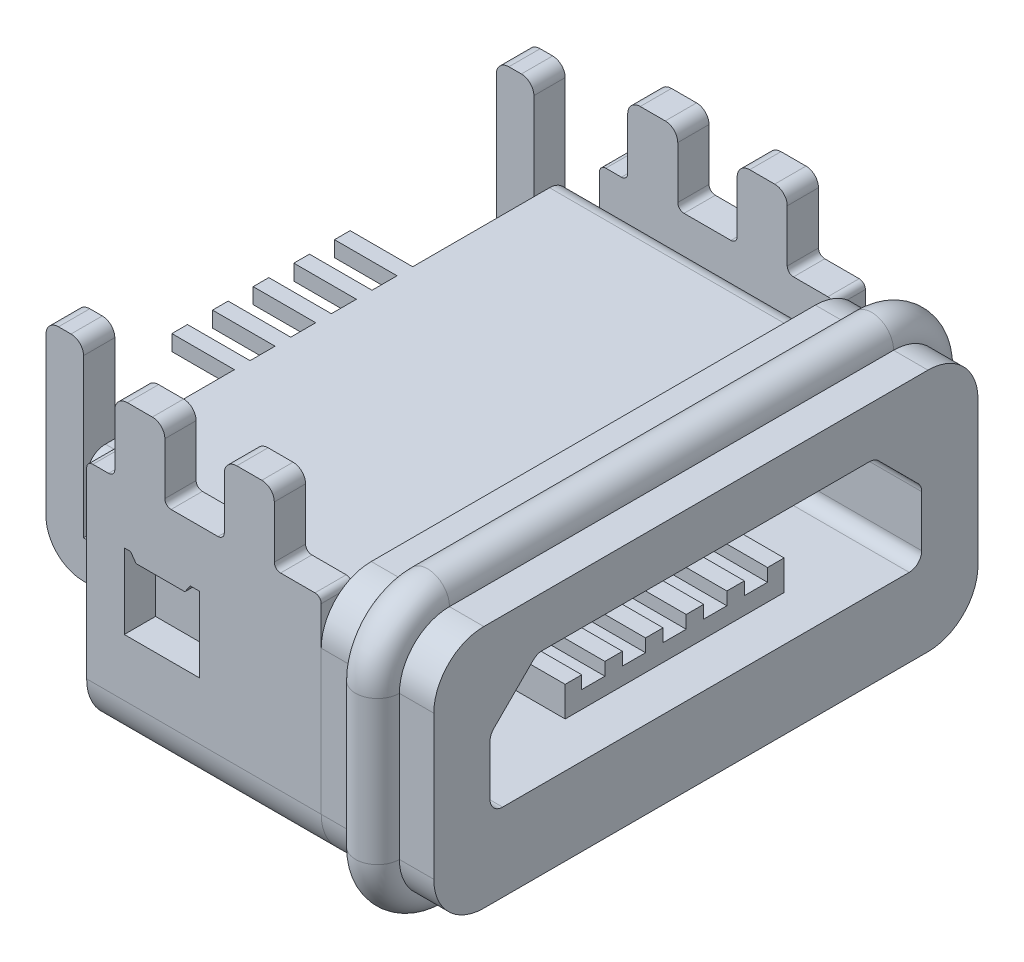
from build123d import *

# Parameters (mm, degrees)
BOSS_EXTRUDE1_DEPTH      = 6.05
CUT_EXTRUDE1_START       = -4.25
CUT_EXTRUDE1_DEPTH       = 4.25
SKETCH4_R                = 0.35
SKETCH4_2_R              = 0.35
BOSS_EXTRUDE2_DEPTH      = 3.75
SURFACECUT1_START        = -0.079067832
SURFACECUT1_OUTLINE_W    = 0.45
SURFACECUT1_OUTLINE_H    = 0.5
SURFACECUT1_OUTLINE_W_2  = 0.95
SURFACECUT1_OUTLINE_W_3  = 0.75
SURFACECUT1_DEPTH        = 1.129067832
SURFACECUT1_START_2      = -0.083880527
SURFACECUT1_2_OUTLINE_W  = 0.75
SURFACECUT1_2_OUTLINE_H  = 0.5
SURFACECUT1_2_DEPTH      = 0.004812695
FILLET1_R                = 0.1
FILLET2_R                = 0.2
BOSS_EXTRUDE3_DEPTH      = 0.25
BOSS_EXTRUDE3_DEPTH_BACK = 0.25
SKETCH8_W                = 1
SKETCH8_H                = 0.25
BOSS_EXTRUDE4_DEPTH      = 0.25
CUT_EXTRUDE2_DEPTH       = 3.5
FILLET3_R                = 0.2
BOSS_EXTRUDE5_DEPTH      = 3
SKETCH11_W               = 1
SKETCH11_H               = 1.615622931
CUT_EXTRUDE3_DEPTH       = 23.0814968
SKETCH11_2_W             = 1
SKETCH11_2_H             = 1.615622931
BOSS_EXTRUDE6_DEPTH      = 1.469739
CUT_EXTRUDE4_DEPTH       = 24.25865436
CUT_EXTRUDE4_DEPTH_BACK  = 24.25865436


# Read off the part's stored shape, not the designer's step: SurfaceCut1
with BuildPart() as part:
    # Sketch1 → Boss-Extrude1 (new body)
    with BuildSketch(Plane(origin=(21, 0, 0), x_dir=(0, 0, -1), z_dir=(1, 0, 0))):
        with BuildLine():
            Line((-3.55, -3.9), (3.55, -3.9))
            ThreePointArc((3.55, -3.9), (4.115685425, -3.665685425), (4.35, -3.1))
            Line((4.35, -3.1), (4.35, -0.8))
            ThreePointArc((4.35, -0.8), (4.115685425, -0.234314575), (3.55, 0))
            Line((3.55, 0), (-3.55, 0))
            ThreePointArc((-3.55, 0), (-4.115685425, -0.234314575), (-4.35, -0.8))
            Line((-4.35, -0.8), (-4.35, -3.1))
            ThreePointArc((-4.35, -3.1), (-4.115685425, -3.665685425), (-3.55, -3.9))
        make_face()
    extrude(amount=-BOSS_EXTRUDE1_DEPTH)

    # Sketch2 → Cut-Extrude1 (cut)
    with BuildSketch(Plane.ZY.offset(-14.95).offset(CUT_EXTRUDE1_START)):
        with BuildLine():
            Line((4.35, -3.1), (4.35, -0.8))
            ThreePointArc((4.35, -0.8), (4.115685425, -0.234314575), (3.55, 0))
            Line((3.55, 0), (-3.55, 0))
            ThreePointArc((-3.55, 0), (-4.115685425, -0.234314575), (-4.35, -0.8))
            Line((-4.35, -0.8), (-4.35, -3.1))
            ThreePointArc((-4.35, -3.1), (-4.115685425, -3.665685425), (-3.55, -3.9))
            Line((-3.55, -3.9), (3.55, -3.9))
            ThreePointArc((3.55, -3.9), (4.115685425, -3.665685425), (4.35, -3.1))
        make_face()
        with BuildLine():
            Line((3.55, -0.5), (-3.55, -0.5))
            ThreePointArc((-3.55, -0.5), (-3.762132034, -0.587867966), (-3.85, -0.8))
            Line((-3.85, -0.8), (-3.85, -3.1))
            ThreePointArc((-3.85, -3.1), (-3.762132034, -3.312132034), (-3.55, -3.4))
            Line((-3.55, -3.4), (3.55, -3.4))
            ThreePointArc((3.55, -3.4), (3.762132034, -3.312132034), (3.85, -3.1))
            Line((3.85, -3.1), (3.85, -0.8))
            ThreePointArc((3.85, -0.8), (3.762132034, -0.587867966), (3.55, -0.5))
        make_face(mode=Mode.SUBTRACT)
    extrude(amount=CUT_EXTRUDE1_DEPTH, mode=Mode.SUBTRACT)

    # Cut-Sweep1: sweep along a path in Sketch3
    with BuildLine(Plane(origin=(20.1, 0, 0), x_dir=(0, 0, -1), z_dir=(1, 0, 0))) as cut_sweep1_path:
        Line((-3.55, -3.9), (3.55, -3.9))
        ThreePointArc((3.55, -3.9), (4.115685425, -3.665685425), (4.35, -3.1))
        Line((4.35, -3.1), (4.35, -0.8))
        ThreePointArc((4.35, -0.8), (4.115685425, -0.234314575), (3.55, 0))
        Line((3.55, 0), (-3.55, 0))
        ThreePointArc((-3.55, 0), (-4.115685425, -0.234314575), (-4.35, -0.8))
        Line((-4.35, -0.8), (-4.35, -3.1))
        ThreePointArc((-4.35, -3.1), (-4.115685425, -3.665685425), (-3.55, -3.9))
    # Sketch4 → Cut-Sweep1 (sweep, cut)
    with BuildSketch(Plane.XY):
        with Locations((20.1, 0)):
            Circle(SKETCH4_R)
    sweep(path=cut_sweep1_path.line, mode=Mode.SUBTRACT)

    # Sketch8 → Boss-Extrude4 (add)
    with BuildSketch(Plane(origin=(0, -0.5, 0), x_dir=(1, 0, 0), z_dir=(0, 1, 0))):
        with Locations((14.45, -0.062906509)):
            Rectangle(SKETCH8_W, SKETCH8_H)
        with Locations((14.45, 0.587093491)):
            Rectangle(SKETCH8_W, SKETCH8_H)
        with Locations((14.45, 1.237093491)):
            Rectangle(SKETCH8_W, SKETCH8_H)
        with Locations((14.45, -0.712906509)):
            Rectangle(SKETCH8_W, SKETCH8_H)
        with Locations((14.45, -1.362906509)):
            Rectangle(SKETCH8_W, SKETCH8_H)
    extrude(amount=-BOSS_EXTRUDE4_DEPTH)

    # Sketch9 → Cut-Extrude2 (cut)
    with BuildSketch(Plane(origin=(21, 0, 0), x_dir=(0, 0, -1), z_dir=(1, 0, 0))):
        Polygon((-3.45, -2.650260781), (3.45, -2.650260781), (3.45, -1.550260781), (2.7, -0.800260781), (-2.7, -0.800260781), (-3.45, -1.550260781), align=None)
    extrude(amount=-CUT_EXTRUDE2_DEPTH, mode=Mode.SUBTRACT)

    # Fillet3
    fillet3_edges = [part.edges().sort_by_distance(p)[0] for p in [
        (19.25, -2.650260781, -3.45),
        (19.25, -2.650260781, 3.45),
        (19.25, -1.550260781, 3.45),
        (19.25, -0.800260781, 2.7),
        (19.25, -0.800260781, -2.7),
        (19.25, -1.550260781, -3.45),
    ]]
    fillet(fillet3_edges, radius=FILLET3_R)

    # Sketch11<2> → Boss-Extrude6 (add)
    with BuildSketch(Plane.XZ.offset(3.9)):
        with Locations((18.7, 0.062906509)):
            Rectangle(SKETCH11_2_W, SKETCH11_2_H)
    extrude(amount=-BOSS_EXTRUDE6_DEPTH)


with BuildPart() as body_2:
    # Sweep1: sweep along a path in Sketch3<2>
    with BuildLine(Plane(origin=(20.1, 0, 0), x_dir=(0, 0, -1), z_dir=(1, 0, 0))) as sweep1_path:
        Line((-3.55, -3.9), (3.55, -3.9))
        ThreePointArc((3.55, -3.9), (4.115685425, -3.665685425), (4.35, -3.1))
        Line((4.35, -3.1), (4.35, -0.8))
        ThreePointArc((4.35, -0.8), (4.115685425, -0.234314575), (3.55, 0))
        Line((3.55, 0), (-3.55, 0))
        ThreePointArc((-3.55, 0), (-4.115685425, -0.234314575), (-4.35, -0.8))
        Line((-4.35, -0.8), (-4.35, -3.1))
        ThreePointArc((-4.35, -3.1), (-4.115685425, -3.665685425), (-3.55, -3.9))
    # Sketch4<2> → Sweep1 (sweep)
    with BuildSketch(Plane.XY):
        with Locations((20.1, 0)):
            Circle(SKETCH4_2_R)
    sweep(path=sweep1_path.line)


with BuildPart() as body_3:
    # Sketch5 → Boss-Extrude2 (new body)
    with BuildSketch(Plane.ZY.offset(-19.2)):
        with BuildLine():
            Line((-3.85, -0.8), (-3.85, 1.05))
            Line((-3.85, 1.05), (-4.35, 1.05))
            Line((-4.35, 1.05), (-4.35, -0.8))
            Line((-4.35, -0.8), (-4.35, -3.1))
            ThreePointArc((-4.35, -3.1), (-4.115685425, -3.665685425), (-3.55, -3.9))
            Line((-3.55, -3.9), (3.55, -3.9))
            ThreePointArc((3.55, -3.9), (4.115685425, -3.665685425), (4.35, -3.1))
            Line((4.35, -3.1), (4.35, -0.8))
            Line((4.35, -0.8), (4.35, 1.05))
            Line((4.35, 1.05), (3.85, 1.05))
            Line((3.85, 1.05), (3.85, -0.8))
            Line((3.85, -0.8), (3.85, -3.1))
            ThreePointArc((3.85, -3.1), (3.762132034, -3.312132034), (3.55, -3.4))
            Line((3.55, -3.4), (-3.55, -3.4))
            ThreePointArc((-3.55, -3.4), (-3.762132034, -3.312132034), (-3.85, -3.1))
            Line((-3.85, -3.1), (-3.85, -0.8))
        make_face()
    extrude(amount=BOSS_EXTRUDE2_DEPTH)

    # SurfaceCut1 outline → SurfaceCut1 (cut)
    with BuildSketch(Plane(origin=(0, 0, 0), x_dir=(1, 0, 0), z_dir=(0, 1, 0)).offset(SURFACECUT1_START)):
        with Locations((15.675, -4.1)):
            Rectangle(SURFACECUT1_OUTLINE_W, SURFACECUT1_OUTLINE_H)
        with Locations((17.175, -4.1)):
            Rectangle(SURFACECUT1_OUTLINE_W_2, SURFACECUT1_OUTLINE_H)
        with Locations((15.675, 4.1)):
            Rectangle(SURFACECUT1_OUTLINE_W, SURFACECUT1_OUTLINE_H)
        with Locations((18.825, -4.1)):
            Rectangle(SURFACECUT1_OUTLINE_W_3, SURFACECUT1_OUTLINE_H)
        with Locations((17.175, 4.1)):
            Rectangle(SURFACECUT1_OUTLINE_W_2, SURFACECUT1_OUTLINE_H)
        with Locations((18.825, 4.1)):
            Rectangle(SURFACECUT1_OUTLINE_W_3, SURFACECUT1_OUTLINE_H)
    extrude(amount=SURFACECUT1_DEPTH, mode=Mode.SUBTRACT)

    # SurfaceCut1 2 outline → SurfaceCut1 2 (cut)
    with BuildSketch(Plane(origin=(0, 0, 0), x_dir=(1, 0, 0), z_dir=(0, 1, 0)).offset(SURFACECUT1_START_2)):
        with Locations((18.825, -4.1)):
            Rectangle(SURFACECUT1_2_OUTLINE_W, SURFACECUT1_2_OUTLINE_H)
        with Locations((18.825, 4.1)):
            Rectangle(SURFACECUT1_2_OUTLINE_W, SURFACECUT1_2_OUTLINE_H)
    extrude(amount=SURFACECUT1_2_DEPTH, mode=Mode.SUBTRACT)

    # Fillet1
    fillet1_edges = [body_3.edges().sort_by_distance(p)[0] for p in [
        (19.2, -0.083880527, 4.1),
        (15.45, -0.079067832, 4.1),
        (15.45, -0.079067832, -4.1),
        (18.45, -0.083880527, -4.1),
        (18.45, -0.083880527, 4.1),
        (17.65, -0.079067832, -4.1),
        (17.65, -0.079067832, 4.1),
        (16.7, -0.079067832, -4.1),
        (16.7, -0.079067832, 4.1),
        (15.9, -0.079067832, -4.1),
        (15.9, -0.079067832, 4.1),
        (19.2, -0.083880527, -4.1),
    ]]
    fillet(fillet1_edges, radius=FILLET1_R)

    # Fillet2
    fillet2_edges = [body_3.edges().sort_by_distance(p)[0] for p in [
        (18.45, 1.05, -4.1),
        (18.45, 1.05, 4.1),
        (17.65, 1.05, -4.1),
        (17.65, 1.05, 4.1),
        (16.7, 1.05, -4.1),
        (16.7, 1.05, 4.1),
        (15.9, 1.05, -4.1),
        (15.9, 1.05, 4.1),
    ]]
    fillet(fillet2_edges, radius=FILLET2_R)

    # Sketch11 → Cut-Extrude3 (cut, through all)
    with BuildSketch(Plane.XZ.offset(3.9)):
        with Locations((18.7, 0.062906509)):
            Rectangle(SKETCH11_W, SKETCH11_H)
    extrude(amount=-CUT_EXTRUDE3_DEPTH, mode=Mode.SUBTRACT)

    # Sketch12 → Cut-Extrude4 (cut, two sides: drawn at the far end of the back side and taken through both)
    with BuildSketch(Plane(origin=(0, 0, -4.35), x_dir=(-1, 0, 0), z_dir=(0, 0, -1)).offset(-CUT_EXTRUDE4_DEPTH_BACK)):
        Polygon((-17.107864763, -0.984837359), (-17.019575108, -1.108559441), (-16.239638576, -1.108559441), (-16.151348921, -0.984837359), (-16.051347809, -0.984837359), (-16.051347809, -2.184837359), (-17.251347809, -2.184837359), (-17.251347809, -0.984837359), align=None)
    extrude(amount=CUT_EXTRUDE4_DEPTH + CUT_EXTRUDE4_DEPTH_BACK, mode=Mode.SUBTRACT)


with BuildPart() as body_4:
    # Sketch7 → Boss-Extrude3 (new, two sides: drawn at the far end of the back side and taken through both)
    with BuildSketch(Plane.XY.offset(3.6).offset(-BOSS_EXTRUDE3_DEPTH_BACK)):
        with BuildLine():
            Line((14.7, 1.05), (14.5, 1.05))
            ThreePointArc((14.5, 1.05), (14.358578644, 0.991421356), (14.3, 0.85))
            Line((14.3, 0.85), (14.3, -1.672412117))
            ThreePointArc((14.3, -1.672412117), (14.475735931, -2.096676185), (14.9, -2.272412117))
            Line((14.9, -2.272412117), (14.95, -2.272412117))
            Line((14.95, -2.272412117), (14.95, -1.672412117))
            Line((14.95, -1.672412117), (14.9, -1.672412117))
            Line((14.9, -1.672412117), (14.9, 0.85))
            ThreePointArc((14.9, 0.85), (14.841421356, 0.991421356), (14.7, 1.05))
        make_face()
    extrude(amount=BOSS_EXTRUDE3_DEPTH + BOSS_EXTRUDE3_DEPTH_BACK)


with BuildPart() as body_5:
    # Mirror1: mirrored copy
    add(body_4.part.mirror(Plane.XY))


with BuildPart() as body_6:
    # Sketch10 → Boss-Extrude5 (new body)
    with BuildSketch(Plane(origin=(17.5, 0, 0), x_dir=(0, 0, -1), z_dir=(1, 0, 0))):
        Polygon((-1.75, -1.950260781), (-1.485, -1.950260781), (-1.485, -2.155321077), (-1.115, -2.155321077), (-1.115, -1.950260781), (-0.835, -1.950260781), (-0.835, -2.155321077), (-0.465, -2.155321077), (-0.465, -1.950260781), (-0.185, -1.950260781), (-0.185, -2.155321077), (0.185, -2.155321077), (0.185, -1.950260781), (0.465, -1.950260781), (0.465, -2.155321077), (0.835, -2.155321077), (0.835, -1.950260781), (1.115, -1.950260781), (1.115, -2.155321077), (1.485, -2.155321077), (1.485, -1.950260781), (1.75, -1.950260781), (1.75, -2.430260781), (-1.75, -2.430260781), align=None)
    extrude(amount=BOSS_EXTRUDE5_DEPTH)


solid = Compound([part.part, body_2.part, body_3.part, body_4.part, body_5.part, body_6.part])
